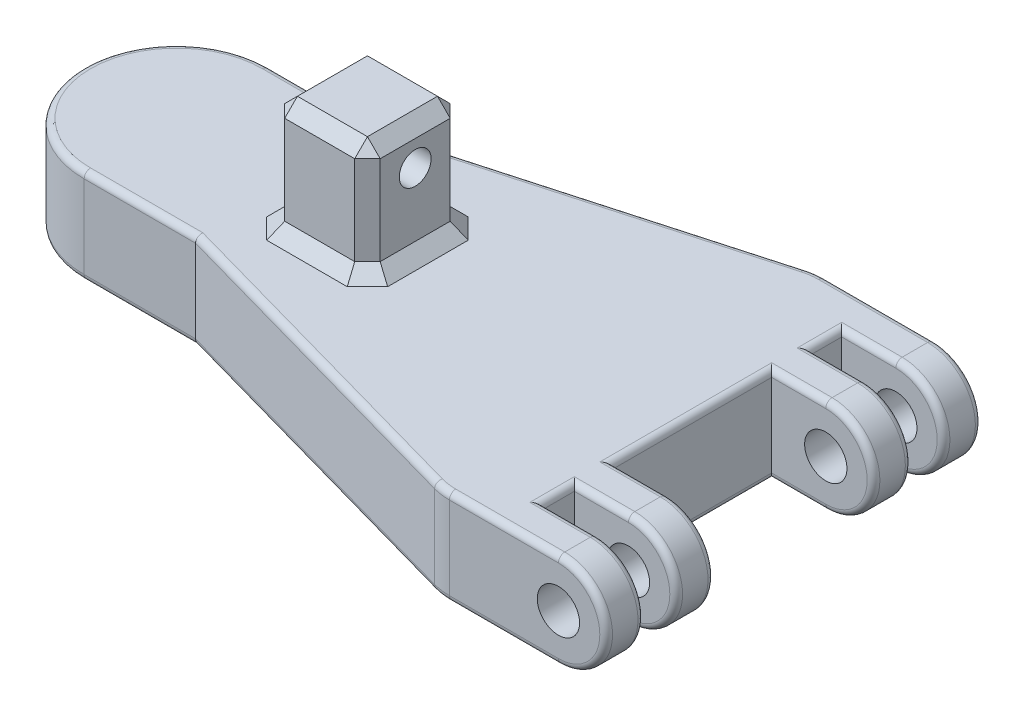
from build123d import *

# Parameters (mm, degrees)
SKETCH2_R                      = 4.22275
INITIAL_GROOVE_DEPTH           = 7.62
GROOVE_LINEAR_PATTERN_COUNT    = 2
GROOVE_LINEAR_PATTERN_PITCH    = 13.97
LPATTERN2_COUNT                = 2
LPATTERN2_PITCH                = 39.37
LPATTERN3_COUNT                = 2
LPATTERN3_PITCH                = 13.97
SKETCH2_5_W                    = 30.48
SKETCH2_5_H                    = 9.525
MAIN_BODY_EXTRUDE_DEPTH        = 74.93
BOSS_EXTRUDE1_DEPTH            = 9.525
BOSS_EXTRUDE1_DEPTH_BACK       = 9.525
SKETCH7_W                      = 19.05
SKETCH7_H                      = 19.05
ANKLE_CONNECTION_EXTRUDE_DEPTH = 22.86
SKETCH8_R                      = 3.175
PINHOLE_2_DEPTH                = 22.86
CUT_EXTRUDE1_DEPTH             = 154.565005454
CUT_EXTRUDE1_DEPTH_BACK        = 154.565005454
FILLET6_R                      = 1.27
FILLET1_R                      = 1.27
CHAMFER2_SIZE                  = 2.54
FILLET8_R                      = 12.7
CHAMFER3_SIZE                  = 2.54


with BuildPart() as part:
    # Sketch2 → Initial Groove (new body)
    with BuildSketch(Plane.XY):
        with BuildLine():
            Line((-41.275, -9.525), (0, -9.525))
            ThreePointArc((0, -9.525), (9.525, 0), (0, 9.525))
            Line((0, 9.525), (-41.275, 9.525))
            Line((-41.275, 9.525), (-41.275, -9.525))
        make_face()
        with Locations(Location((0, 0, 0), (0, 0, 180))):
            Circle(SKETCH2_R, mode=Mode.SUBTRACT)
    extrude(amount=INITIAL_GROOVE_DEPTH)


with BuildPart() as groove_linear_pattern_1:
    # Groove Linear Pattern: pattern copy
    add(part.part.moved(Location(Vector(0, 0, 1) * (1 * GROOVE_LINEAR_PATTERN_PITCH))))


with BuildPart() as lpattern2_1:
    # LPattern2: pattern copy
    add(groove_linear_pattern_1.part.moved(Location(Vector(0, 0, 1) * (1 * LPATTERN2_PITCH))))


with BuildPart() as lpattern3_1:
    # LPattern3: pattern copy
    add(lpattern2_1.part.moved(Location(Vector(0, 0, 1) * (1 * LPATTERN3_PITCH))))


with BuildPart() as part_1:
    add(part.part)

    add(groove_linear_pattern_1.part)  # Main Body Extrude merges Groove Linear Pattern_1

    add(lpattern2_1.part)  # Main Body Extrude merges LPattern2_1

    add(lpattern3_1.part)  # Main Body Extrude merges LPattern3_1
    # Sketch2<5> → Main Body Extrude (add)
    with BuildSketch(Plane.XY):
        Polygon((-91.44, -9.525), (-41.275, -9.525), (-41.275, 0), (-41.275, 9.525), (-91.44, 9.525), align=None)
        with Locations((-26.035, -4.7625)):
            Rectangle(SKETCH2_5_W, SKETCH2_5_H)
        with Locations((-26.035, 4.7625)):
            Rectangle(SKETCH2_5_W, SKETCH2_5_H)
    extrude(amount=MAIN_BODY_EXTRUDE_DEPTH)

    # Sketch10 → Boss-Extrude1 (add, two sides: drawn at the far end of the back side and taken through both)
    with BuildSketch(Plane(origin=(0, 0, 0), x_dir=(1, 0, 0), z_dir=(0, 1, 0)).offset(-BOSS_EXTRUDE1_DEPTH_BACK)):
        with BuildLine():
            Line((-91.44, -55.88), (-91.44, -19.05))
            Line((-91.44, -19.05), (-113.665, -19.05))
            ThreePointArc((-113.665, -19.05), (-132.08, -37.465), (-113.665, -55.88))
            Line((-113.665, -55.88), (-91.44, -55.88))
        make_face()
    extrude(amount=BOSS_EXTRUDE1_DEPTH + BOSS_EXTRUDE1_DEPTH_BACK)

    # Sketch7 → Ankle Connection Extrude (add)
    with BuildSketch(Plane(origin=(0, 9.525, 0), x_dir=(1, 0, 0), z_dir=(0, 1, 0))):
        with Locations((-75.565, -37.465)):
            Rectangle(SKETCH7_W, SKETCH7_H)
    extrude(amount=ANKLE_CONNECTION_EXTRUDE_DEPTH)

    # Sketch8 → Pinhole 2 (cut)
    with BuildSketch(Plane(origin=(-85.09, 0, -38.1), x_dir=(0, 0, -1), z_dir=(1, 0, 0))):
        with Locations(Location((-75.565, 24.765, 0), (0, 0, 180))):
            Circle(SKETCH8_R)
    extrude(amount=PINHOLE_2_DEPTH, mode=Mode.SUBTRACT)

    # Sketch13 → Cut-Extrude1 (cut, two sides: drawn at the far end of the back side and taken through both)
    with BuildSketch(Plane(origin=(0, 9.525, 0), x_dir=(1, 0, 0), z_dir=(0, 1, 0)).offset(-CUT_EXTRUDE1_DEPTH_BACK)):
        Polygon((-91.44, -74.93), (-23.495, -74.93), (-91.44, -55.88), align=None)
        Polygon((-91.44, 0), (-91.44, -19.05), (-23.495, 0), align=None)
    extrude(amount=CUT_EXTRUDE1_DEPTH + CUT_EXTRUDE1_DEPTH_BACK, mode=Mode.SUBTRACT)

    # Fillet6
    fillet6_edges = [part_1.edges().sort_by_distance(p)[0] for p in [
        (-102.5525, 9.525, 19.05),
        (-132.08, -9.525, 37.465),
        (-102.5525, -9.525, 55.88),
        (-132.08, 9.525, 37.465),
        (-102.5525, 9.525, 55.88),
        (-102.5525, -9.525, 19.05),
    ]]
    fillet(fillet6_edges, radius=FILLET6_R)

    # Fillet1
    fillet1_edges = [part_1.edges().sort_by_distance(p)[0] for p in [
        (9.525, 0, 7.62),
        (-59.732333333, 9.525, 64.77),
        (-59.732333333, -9.525, 64.77),
        (-59.732333333, 9.525, 10.16),
        (-59.732333333, -9.525, 10.16),
        (-5.3975, 9.525, 7.62),
        (-11.7475, -9.525, 74.93),
        (-11.7475, 9.525, 74.93),
        (-10.795, -9.525, 10.795),
        (-10.795, 9.525, 10.795),
        (-5.3975, -9.525, 21.59),
        (9.525, 0, 13.97),
        (-5.3975, 9.525, 13.97),
        (-5.3975, 9.525, 21.59),
        (9.525, 0, 21.59),
        (-5.3975, -9.525, 13.97),
        (-5.3975, -9.525, 7.62),
        (-10.795, 9.525, 37.465),
        (-10.795, -9.525, 37.465),
        (-5.3975, -9.525, 60.96),
        (9.525, 0, 53.34),
        (-5.3975, 9.525, 53.34),
        (-5.3975, 9.525, 60.96),
        (9.525, 0, 60.96),
        (-5.3975, -9.525, 53.34),
        (-11.7475, 9.525, 0),
        (-10.795, 9.525, 64.135),
        (-10.795, -9.525, 64.135),
        (9.525, 0, 67.31),
        (9.525, 0, 0),
        (-5.3975, 9.525, 67.31),
        (9.525, 0, 74.93),
        (-5.3975, -9.525, 67.31),
        (-11.7475, -9.525, 0),
    ]]
    fillet(fillet1_edges, radius=FILLET1_R)

    # Chamfer2
    chamfer2_edges = [part_1.edges().sort_by_distance(p)[0] for p in [
        (-66.04, 20.955, 27.94),
        (-85.09, 20.955, 27.94),
        (-75.565, 32.385, 46.99),
        (-85.09, 20.955, 46.99),
        (-66.04, 32.385, 37.465),
        (-66.04, 20.955, 46.99),
        (-75.565, 32.385, 27.94),
        (-85.09, 32.385, 37.465),
    ]]
    chamfer(chamfer2_edges, length=CHAMFER2_SIZE)

    # Fillet8
    # the kernel refuses this fillet: 12.7 mm, written as the material it takes off along each edge
    with BuildSketch(Plane(origin=(-21.748303574, -9.525, 62.23), x_dir=(0, 0, 1), z_dir=(1, 0, 0))) as fillet8_piece_1:
        with BuildLine():
            CenterArc((11.43, -1.27), 1.27, 0, 90)
            Line((12.7, -1.27), (12.7, 0))
            Line((12.7, 0), (11.43, 0))
        make_face()
    revolve(axis=Axis((-21.748303574, -9.525, 62.23), (0, -1, 0)), revolution_arc=15.662106345, mode=Mode.SUBTRACT)
    with BuildSketch(Plane(origin=(-21.748303574, 9.525, 62.23), x_dir=(-0.269963692324909, 0, 0.96287050262551), z_dir=(-0.96287050262551, 0, -0.269963692324909))) as fillet8_piece_2:
        with BuildLine():
            CenterArc((11.43, -1.27), 1.27, 0, 90)
            Line((12.7, -1.27), (12.7, 0))
            Line((12.7, 0), (11.43, 0))
        make_face()
    revolve(axis=Axis((-21.748303574, 9.525, 62.23), (0, 1, 0)), revolution_arc=15.662106345, mode=Mode.SUBTRACT)
    with BuildSketch(Plane(origin=(-21.748303574, -9.525, 12.7), x_dir=(-0.2699636923249093, 0, -0.9628705026255098), z_dir=(-0.9628705026255098, 0, 0.2699636923249093))) as fillet8_piece_3:
        with BuildLine():
            CenterArc((11.43, -1.27), 1.27, 0, 90)
            Line((12.7, -1.27), (12.7, 0))
            Line((12.7, 0), (11.43, 0))
        make_face()
    revolve(axis=Axis((-21.748303574, -9.525, 12.7), (0, -1, 0)), revolution_arc=15.662106345, mode=Mode.SUBTRACT)
    with BuildSketch(Plane(origin=(-21.748303574, 9.525, 12.7), x_dir=(0, 0, -1), z_dir=(1, 0, 0))) as fillet8_piece_4:
        with BuildLine():
            CenterArc((11.43, -1.27), 1.27, 0, 90)
            Line((12.7, -1.27), (12.7, 0))
            Line((12.7, 0), (11.43, 0))
        make_face()
    revolve(axis=Axis((-21.748303574, 9.525, 12.7), (0, 1, 0)), revolution_arc=15.662106345, mode=Mode.SUBTRACT)
    with BuildSketch(Plane(origin=(-23.495, -9.525, 74.93), x_dir=(1, 0, 0), z_dir=(0, 1, 0))) as fillet8_piece_5:
        with BuildLine():
            CenterArc((FILLET8_R * 0.137535151689, FILLET8_R), FILLET8_R, 254.337893655, 15.662106345)
            Line((-FILLET8_R * 0.132428540636, FILLET8_R * 0.0371294973745), (0, 0))
            Line((0, 0), (FILLET8_R * 0.137535151689, 0))
        make_face()
    extrude(amount=19.05, mode=Mode.SUBTRACT)
    with BuildSketch(Plane(origin=(-23.495, 9.525, 0), x_dir=(-0.96287050262551, 0, 0.26996369232490863), z_dir=(0, -1, 0))) as fillet8_piece_6:
        with BuildLine():
            CenterArc((FILLET8_R * 0.137535151689, -FILLET8_R), FILLET8_R, 90, 15.662106345)
            Line((-FILLET8_R * 0.132428540636, -FILLET8_R * 0.0371294973745), (0, 0))
            Line((0, 0), (FILLET8_R * 0.137535151689, 0))
        make_face()
    extrude(amount=19.05, mode=Mode.SUBTRACT)

    # Chamfer3
    chamfer3_edges = [part_1.edges().sort_by_distance(p)[0] for p in [
        (-66.04, 9.525, 37.465),
        (-75.565, 9.525, 27.94),
        (-85.09, 9.525, 37.465),
        (-75.565, 9.525, 46.99),
        (-67.31, 9.525, 29.21),
        (-83.82, 9.525, 29.21),
        (-83.82, 9.525, 45.72),
        (-67.31, 9.525, 45.72),
    ]]
    chamfer(chamfer3_edges, length=CHAMFER3_SIZE)


solid = part_1.part
